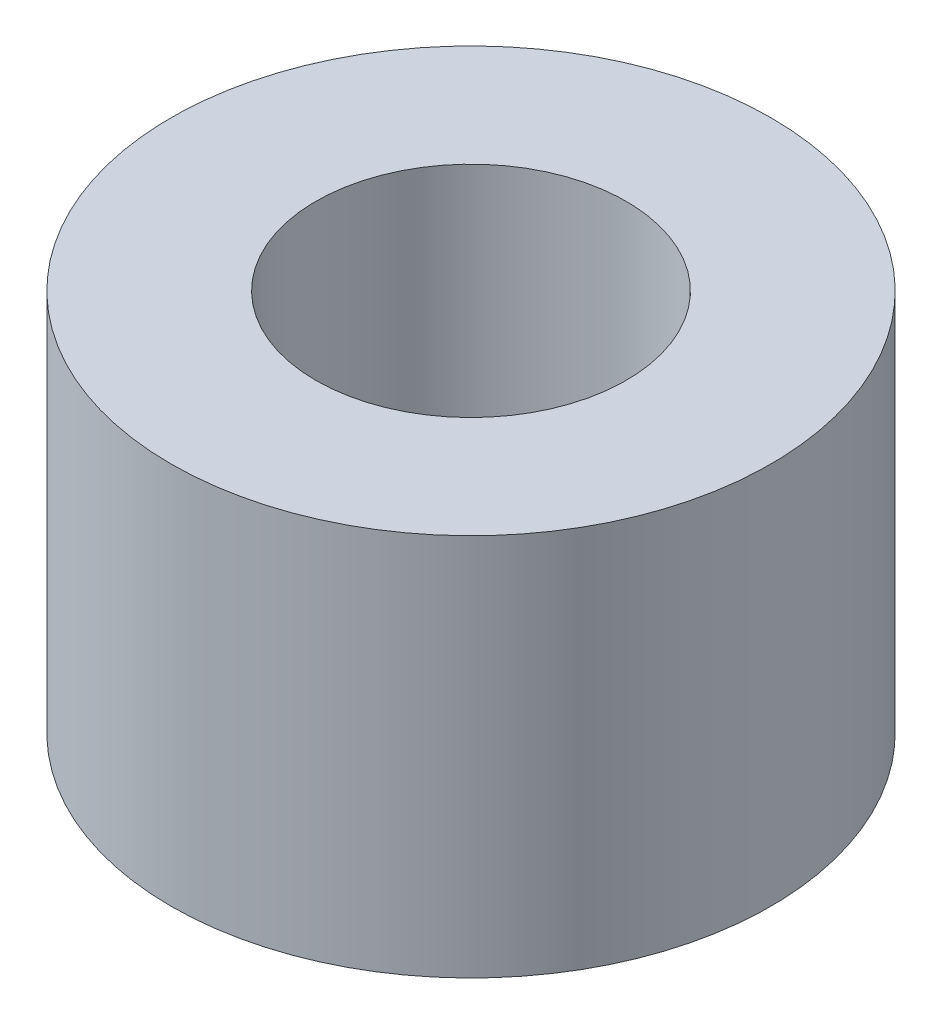
from build123d import *

# Parameters (mm, degrees)
SKETCH1_R           = 15
BOSS_EXTRUDE1_DEPTH = 19.155808051
SKETCH2_R           = 7.760661925
CUT_EXTRUDE1_DEPTH  = 29.582249423


with BuildPart() as part:
    # Sketch1 → Boss-Extrude1 (new body)
    with BuildSketch(Plane(origin=(0, 0, 0), x_dir=(1, 0, 0), z_dir=(0, 1, 0))):
        Circle(SKETCH1_R)
    extrude(amount=BOSS_EXTRUDE1_DEPTH)

    # Sketch2 → Cut-Extrude1 (cut, through all)
    with BuildSketch(Plane(origin=(0, 0, 0), x_dir=(1, 0, 0), z_dir=(0, 1, 0))):
        Circle(SKETCH2_R)
    extrude(amount=CUT_EXTRUDE1_DEPTH, mode=Mode.SUBTRACT)


solid = part.part
